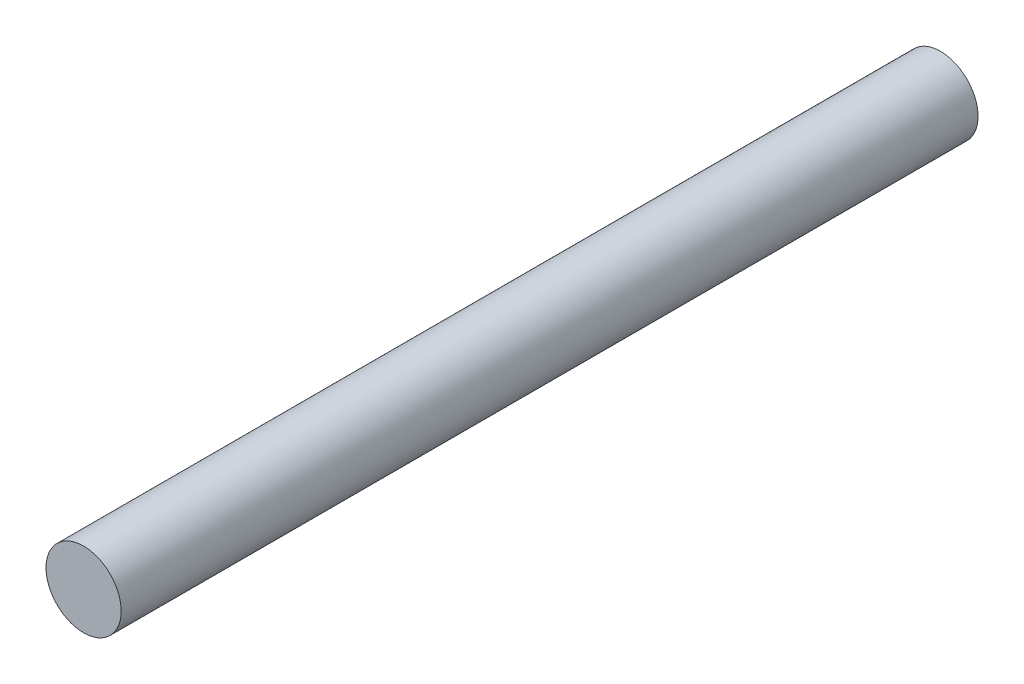
from build123d import *

# Parameters (mm, degrees)
SKETCH_1_R      = 2.5
EXTRUDE_1_DEPTH = 57


with BuildPart() as part:
    # Эскиз1 → Вытянуть1 (new body)
    with BuildSketch(Plane.XY):
        Circle(SKETCH_1_R)
    extrude(amount=EXTRUDE_1_DEPTH)


solid = part.part
